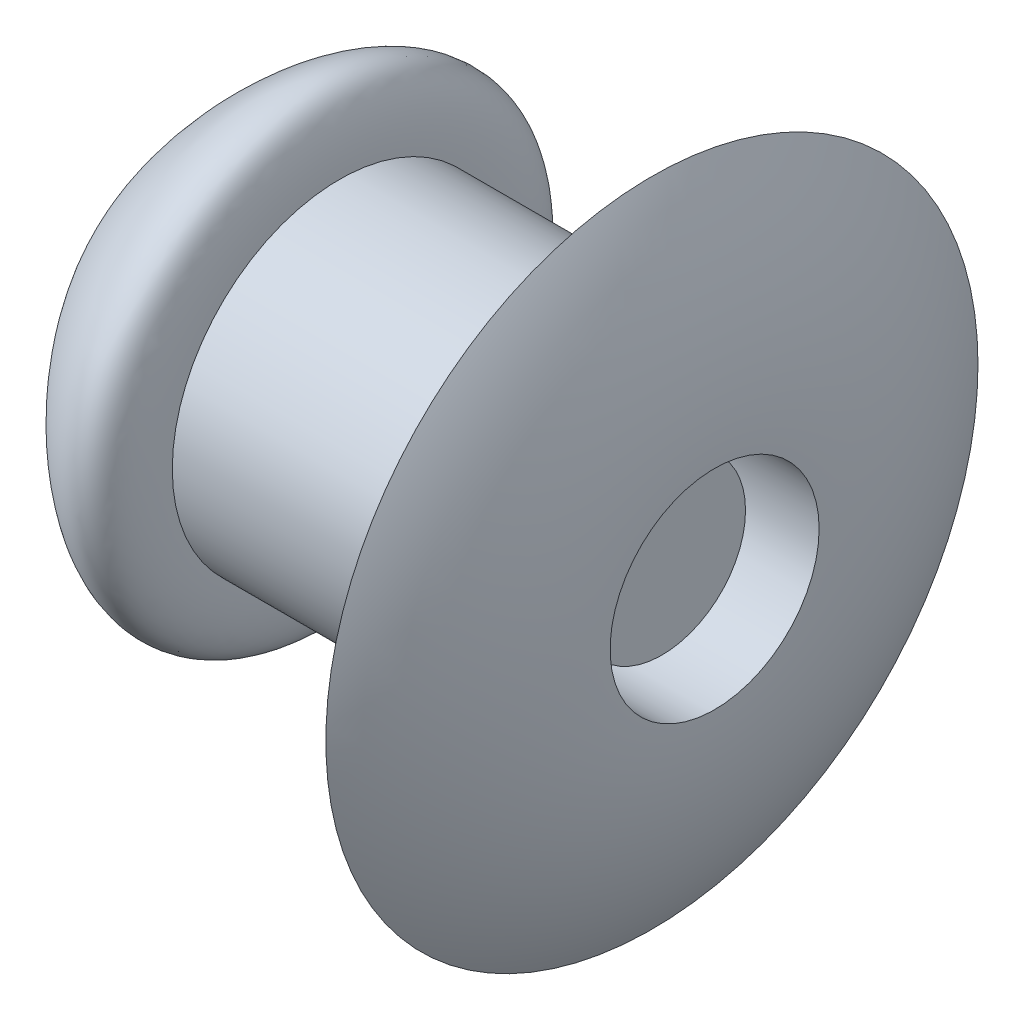
from build123d import *


with BuildPart() as part:
    # Szkic1 → Obrót1 (revolve)
    with BuildSketch(Plane.XY):
        with BuildLine():
            Line((350.856147885, 893.681551629), (345.444477863, 893.681551629))
            add(Edge.make_bspline(
                [(346.055380649, 894.856511413), (345.172357287, 894.874577993), (345.444477863, 893.681551629)],
                knots=[0, 0, 0, 1, 1, 1], degree=2))
            add(Edge.make_bspline(
                [(347.000000014, 895.681551629), (347.036555424, 898.021351685), (343.536594652, 893.309377005), (345.758684651, 895.170148194), (346.055380649, 894.856511413)],
                knots=[0, 0, 0, 0, 0.744501965, 1, 1, 1, 1], degree=3))
            Line((347.000000014, 895.681551629), (350.7366, 895.681551629))
            Line((350.7366, 895.681551629), (350.7366, 897.581551629))
            ThreePointArc((350.7366, 897.581551629), (351.295488572, 896.308595565), (351.4866, 894.931551629))
            Line((351.4866, 894.931551629), (347, 894.931551629))
            Line((347, 894.931551629), (347, 894.681551629))
            Line((347, 894.681551629), (350.856147885, 894.681551629))
            Line((350.856147885, 894.681551629), (350.856147885, 893.681551629))
        make_face()
    revolve(axis=Axis((350.856147885, 893.681551629, 0), (-1, 0, 0)))


solid = part.part
